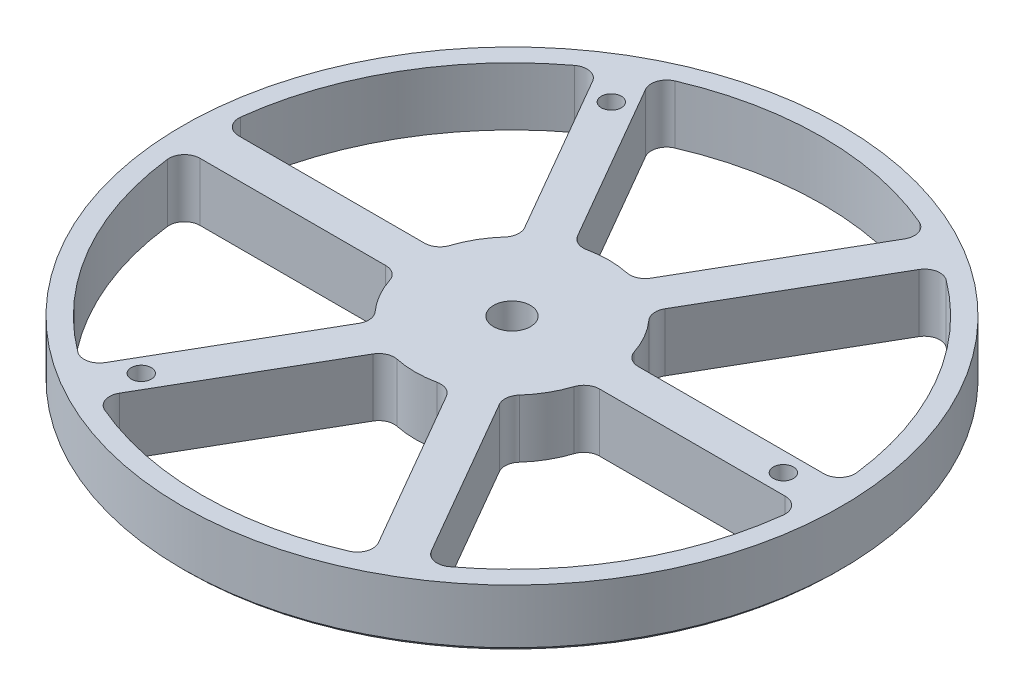
from build123d import *

# Parameters (mm, degrees)
SKETCH2_W                    = 84.99983
SKETCH2_H                    = 15
F_6_0_204_DIAMETER_HOLE1_D   = 5.1816
CIRPATTERN3_COUNT            = 3
CUT_EXTRUDE1_DEPTH           = 122.14017583
FILLET1_R                    = 4
CIRPATTERN4_COUNT            = 6
FILLET1_OF_CIRPATTERN4_R     = 4
CHAMFER2_SIZE                = 1
F_3_8_0_375_DIAMETER_HOLE1_D = 9.525


with BuildPart() as part:
    # Sketch2 → Revolve1 (revolve)
    with BuildSketch(Plane(origin=(0, 0, 0), x_dir=(0, 0, -1), z_dir=(1, 0, 0))):
        with Locations((-42.499915, 7.5)):
            Rectangle(SKETCH2_W, SKETCH2_H)
    revolve(axis=Axis((0, -0.75, 0), (0, 1, 0)))

    # #6 (0.204) Diameter Hole1 (through all)
    with Locations(Plane(origin=(0, 15, 0), x_dir=(1, 0, 0), z_dir=(0, 1, 0))):
        with Locations((-35, 60.621778265)):
            f_6_0_204_diameter_hole1 = Hole(F_6_0_204_DIAMETER_HOLE1_D / 2)

    # CirPattern3: #6 (0.204) Diameter Hole1 ×3 about axis
    cirpattern3_axis = Axis((0, -0.75, 0), (0, 1, 0))
    for i in range(1, CIRPATTERN3_COUNT):
        add(f_6_0_204_diameter_hole1.rotate(cirpattern3_axis, i * 360 / CIRPATTERN3_COUNT), mode=Mode.SUBTRACT)

    # Sketch8 → Cut-Extrude1 (cut, through all)
    with BuildSketch(Plane(origin=(0, 15, 0), x_dir=(1, 0, 0), z_dir=(0, 1, 0))):
        with BuildLine():
            Line((-7.917321695, 23.713203436), (-35.591586371, 71.646435917))
            ThreePointArc((-35.591586371, 71.646435917), (0, 79.99983), (35.591586371, 71.646435917))
            Line((35.591586371, 71.646435917), (7.917321695, 23.713203436))
            ThreePointArc((7.917321695, 23.713203436), (0, 25), (-7.917321695, 23.713203436))
        make_face()
    cut_extrude1 = extrude(amount=-CUT_EXTRUDE1_DEPTH, mode=Mode.SUBTRACT)

    # Fillet1
    fillet1_edges = [part.edges().sort_by_distance(p)[0] for p in [
        (7.917321695, 7.5, -23.713203436),
        (35.591586371, 7.5, -71.646435917),
        (-7.917321695, 7.5, -23.713203436),
        (-35.591586371, 7.5, -71.646435917),
    ]]
    fillet(fillet1_edges, radius=FILLET1_R)

    # CirPattern4: Cut-Extrude1 ×6 about axis
    cirpattern4_axis = Axis((0, -0.75, 0), (0, 1, 0))
    for i in range(1, CIRPATTERN4_COUNT):
        add(cut_extrude1.rotate(cirpattern4_axis, i * 360 / CIRPATTERN4_COUNT), mode=Mode.SUBTRACT)

    # Fillet1 of CirPattern4
    fillet1_of_cirpattern4_edges = [part.edges().sort_by_distance(p)[0] for p in [
        (-16.577575733, 7.5, -18.713203436),
        (-44.251840409, 7.5, -66.646435917),
        (-24.494897428, 7.5, -5),
        (-79.84342678, 7.5, -5),
        (-24.494897428, 7.5, 5),
        (-79.84342678, 7.5, 5),
        (-16.577575733, 7.5, 18.713203436),
        (-44.251840409, 7.5, 66.646435917),
        (-7.917321695, 7.5, 23.713203436),
        (-35.591586371, 7.5, 71.646435917),
        (7.917321695, 7.5, 23.713203436),
        (35.591586371, 7.5, 71.646435917),
        (16.577575733, 7.5, 18.713203436),
        (44.251840409, 7.5, 66.646435917),
        (24.494897428, 7.5, 5),
        (79.84342678, 7.5, 5),
        (24.494897428, 7.5, -5),
        (79.84342678, 7.5, -5),
        (16.577575733, 7.5, -18.713203436),
        (44.251840409, 7.5, -66.646435917),
    ]]
    fillet(fillet1_of_cirpattern4_edges, radius=FILLET1_OF_CIRPATTERN4_R)

    # Chamfer2
    chamfer2_edges = [part.edges().sort_by_distance(p)[0] for p in [
        (0, 0, -84.99983),
    ]]
    chamfer(chamfer2_edges, length=CHAMFER2_SIZE)

    # 3/8 (0.375) Diameter Hole1 (through all)
    with Locations(Plane(origin=(0, 0, 0), x_dir=(-1, 0, 0), z_dir=(0, -1, 0))):
        with Locations((0, 0)):
            Hole(F_3_8_0_375_DIAMETER_HOLE1_D / 2)


solid = part.part
